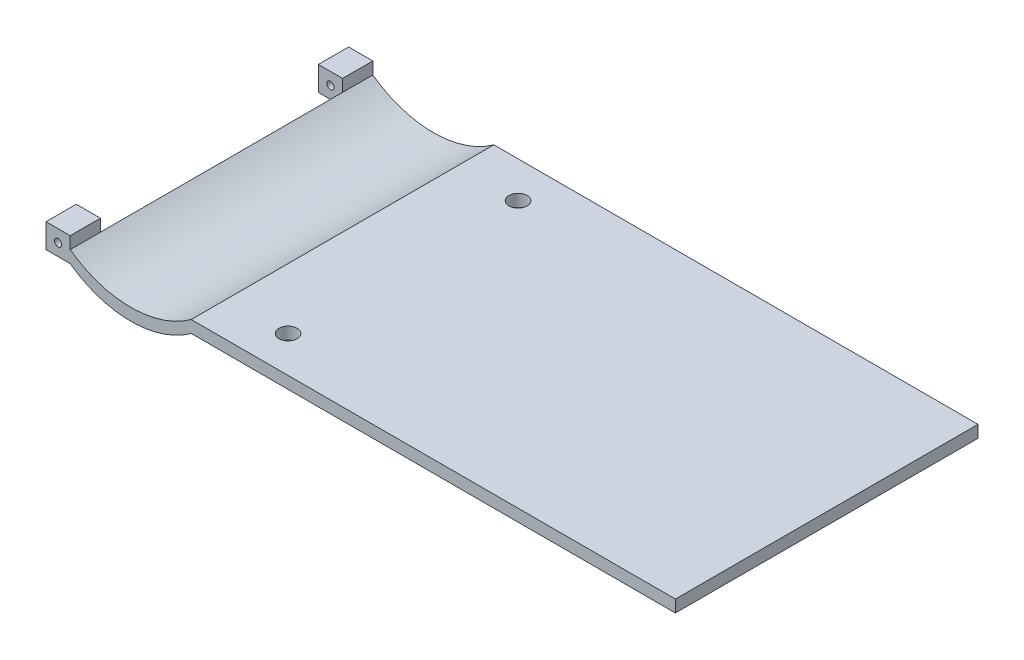
from build123d import *

# Parameters (mm, degrees)
SKETCH_1_R          = 6
EXTRUDE_1_DEPTH     = 500
SKETCH_5_R          = 15
CUT_EXTRUDE_2_DEPTH = 814.854186619
SKETCH_6_W          = 40
SKETCH_6_H          = 400
CUT_EXTRUDE_3_DEPTH = 816.389199244


with BuildPart() as part:
    # 草图1 → 凸台-拉伸1 (new body)
    with BuildSketch(Plane.XY):
        with BuildLine():
            Line((-400, -10), (400, -10))
            Line((400, -10), (400, 10))
            Line((400, 10), (-400, 10))
            ThreePointArc((-400, 10), (-500, -22.522729151), (-600, 10))
            Line((-600, 10), (-600, 30))
            Line((-600, 30), (-640, 30))
            Line((-640, 30), (-640, -10))
            Line((-640, -10), (-600, -10))
            ThreePointArc((-600, -10), (-500, -42.522729151), (-400, -10))
        make_face()
        with Locations((-620, 10)):
            Circle(SKETCH_1_R, mode=Mode.SUBTRACT)
    extrude(amount=EXTRUDE_1_DEPTH)

    # 草图5 → 切除-拉伸2 (cut, through all)
    with BuildSketch(Plane(origin=(0, 10, 0), x_dir=(1, 0, 0), z_dir=(0, 1, 0))):
        with Locations((-300, -60)):
            Circle(SKETCH_5_R)
        with Locations((-300, -440)):
            Circle(SKETCH_5_R)
    extrude(amount=-CUT_EXTRUDE_2_DEPTH, mode=Mode.SUBTRACT)

    # 草图6 → 切除-拉伸3 (cut, through all)
    with BuildSketch(Plane(origin=(0, 30, 0), x_dir=(1, 0, 0), z_dir=(0, 1, 0))):
        with Locations((-620, -250)):
            Rectangle(SKETCH_6_W, SKETCH_6_H)
    extrude(amount=-CUT_EXTRUDE_3_DEPTH, mode=Mode.SUBTRACT)


solid = part.part
